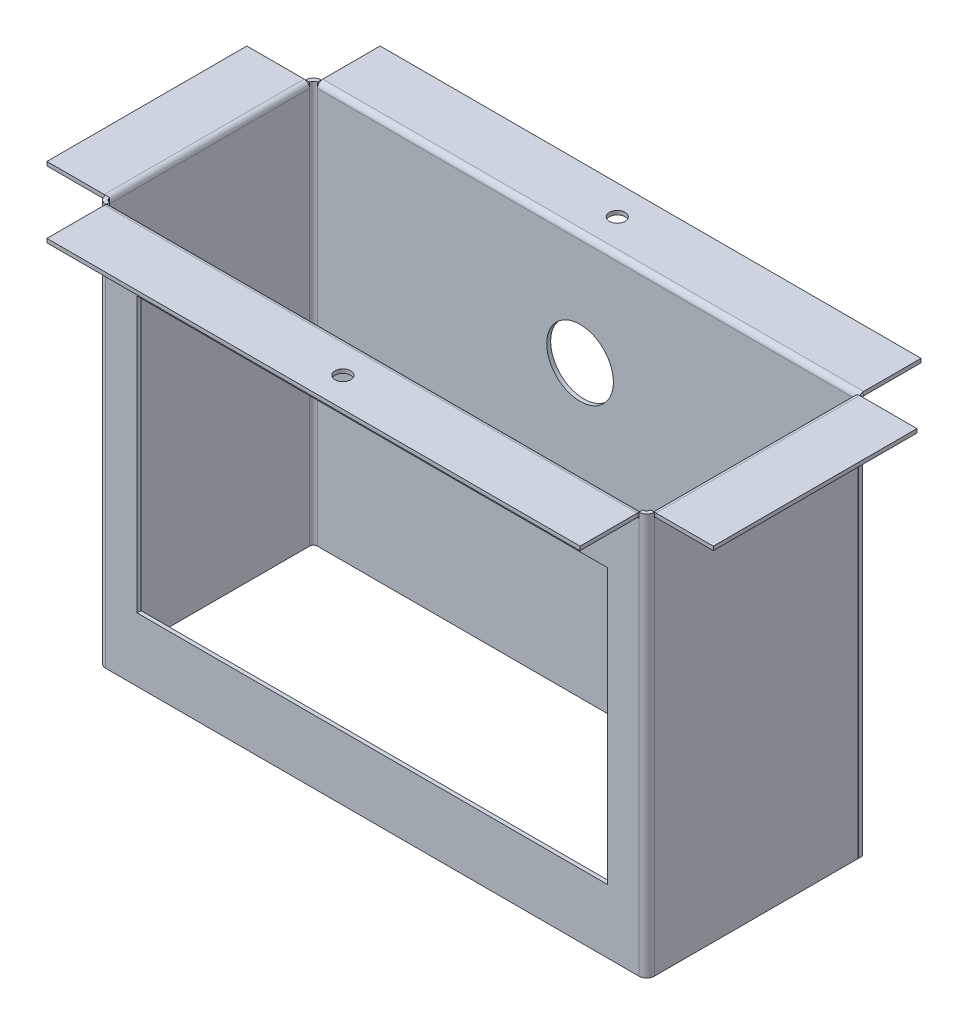
from build123d import *

# Parameters (mm, degrees)
SKETCH1_W                       = 280
SKETCH1_H                       = 205
BASE_FLANGE1_DEPTH              = 2
EDGE_FLANGE1_STRIP_W            = 12
EDGE_FLANGE1_STRIP_H            = 2
EDGE_FLANGE1_STRIP_CUT_DEPTH    = 205
EDGE_FLANGE1_DEPTH              = 205
EDGE_FLANGE2_STRIP_W            = 12
EDGE_FLANGE2_STRIP_H            = 2
EDGE_FLANGE2_STRIP_CUT_DEPTH    = 205
EDGE_FLANGE2_DEPTH              = 205
EDGE_FLANGE3_STRIP_W            = 12
EDGE_FLANGE3_STRIP_H            = 2
EDGE_FLANGE3_STRIP_CUT_DEPTH    = 205
EDGE_FLANGE3_DEPTH              = 205
SKETCH15_W                      = 240
SKETCH15_H                      = 140
CUT_EXTRUDE1_DEPTH              = 10
SKETCH16_R                      = 17
CUT_EXTRUDE2_DEPTH              = 10
EDGE_FLANGE11_STRIP_W           = 9.4732
EDGE_FLANGE11_STRIP_H           = 2
EDGE_FLANGE11_STRIP_CUT_DEPTH   = 276
EDGE_FLANGE11_STRIP_2_W         = 9.4732
EDGE_FLANGE11_STRIP_2_H         = 2
EDGE_FLANGE11_STRIP_CUT_2_DEPTH = 102
EDGE_FLANGE11_STRIP_3_W         = 9.4732
EDGE_FLANGE11_STRIP_3_H         = 2
EDGE_FLANGE11_STRIP_CUT_3_DEPTH = 272
EDGE_FLANGE11_STRIP_4_W         = 9.4732
EDGE_FLANGE11_STRIP_4_H         = 2
EDGE_FLANGE11_STRIP_CUT_4_DEPTH = 103.9
EDGE_FLANGE11_DEPTH             = 276
EDGE_FLANGE11_BEND_DEPTH        = 102
EDGE_FLANGE11_BEND_2_DEPTH      = 272
EDGE_FLANGE11_BEND_3_DEPTH      = 103.9
SKETCH55_R                      = 4
CUT_EXTRUDE3_DEPTH              = 10


# Sheet-metal steps are written as plain solids
with BuildPart() as part:
    # Sketch1 → Base-Flange1 (new body)
    with BuildSketch(Plane.XY):
        with Locations((-95.977777778, -56.488888889)):
            Rectangle(SKETCH1_W, SKETCH1_H)
    extrude(amount=-BASE_FLANGE1_DEPTH)

    # Edge-Flange1 strip (across the edge) → Edge-Flange1 strip cut (cut)
    with BuildSketch(Plane(origin=(-235.977777778, 46.011111111, 0), x_dir=(1, 0, 0), z_dir=(0, -1, 0))):
        with Locations((-2, -1)):
            Rectangle(EDGE_FLANGE1_STRIP_W, EDGE_FLANGE1_STRIP_H)
    extrude(amount=EDGE_FLANGE1_STRIP_CUT_DEPTH, mode=Mode.SUBTRACT)

    # Edge-Flange1 section (across the edge) → Edge-Flange1 (add)
    with BuildSketch(Plane(origin=(-235.977777778, 46.011111111, 0), x_dir=(1, 0, 0), z_dir=(0, -1, 0))):
        with BuildLine():
            Line((0, 2), (0, 108))
            Line((0, 108), (2, 108))
            Line((2, 108), (2, 2))
            ThreePointArc((2, 2), (2.585786438, 0.585786438), (4, 0))
            Line((4, 0), (4, -2))
            ThreePointArc((4, -2), (1.171572875, -0.828427125), (0, 2))
        make_face()
    extrude(amount=EDGE_FLANGE1_DEPTH)

    # Edge-Flange2 strip (across the edge) → Edge-Flange2 strip cut (cut)
    with BuildSketch(Plane(origin=(-233.977777778, 46.011111111, 108), x_dir=(0, 0, -1), z_dir=(0, -1, 0))):
        with Locations((-2, -1)):
            Rectangle(EDGE_FLANGE2_STRIP_W, EDGE_FLANGE2_STRIP_H)
    extrude(amount=EDGE_FLANGE2_STRIP_CUT_DEPTH, mode=Mode.SUBTRACT)

    # Edge-Flange2 section (across the edge) → Edge-Flange2 (add)
    with BuildSketch(Plane(origin=(-233.977777778, 46.011111111, 108), x_dir=(0, 0, -1), z_dir=(0, -1, 0))):
        with BuildLine():
            Line((0, 2), (0, 278))
            Line((0, 278), (2, 278))
            Line((2, 278), (2, 2))
            ThreePointArc((2, 2), (2.585786438, 0.585786438), (4, 0))
            Line((4, 0), (4, -2))
            ThreePointArc((4, -2), (1.171572875, -0.828427125), (0, 2))
        make_face()
    extrude(amount=EDGE_FLANGE2_DEPTH)

    # Edge-Flange3 strip (across the edge) → Edge-Flange3 strip cut (cut)
    with BuildSketch(Plane(origin=(44.022222222, 46.011111111, 106), x_dir=(-1, 0, 0), z_dir=(0, -1, 0))):
        with Locations((-2, -1)):
            Rectangle(EDGE_FLANGE3_STRIP_W, EDGE_FLANGE3_STRIP_H)
    extrude(amount=EDGE_FLANGE3_STRIP_CUT_DEPTH, mode=Mode.SUBTRACT)

    # Edge-Flange3 section (across the edge) → Edge-Flange3 (add)
    with BuildSketch(Plane(origin=(44.022222222, 46.011111111, 106), x_dir=(-1, 0, 0), z_dir=(0, -1, 0))):
        with BuildLine():
            Line((0, 2), (0, 105.9))
            Line((0, 105.9), (2, 105.9))
            Line((2, 105.9), (2, 2))
            ThreePointArc((2, 2), (2.585786438, 0.585786438), (4, 0))
            Line((4, 0), (4, -2))
            ThreePointArc((4, -2), (1.171572875, -0.828427125), (0, 2))
        make_face()
    extrude(amount=EDGE_FLANGE3_DEPTH)

    # Sketch15 → Cut-Extrude1 (cut)
    with BuildSketch(Plane.XY.offset(108)):
        with Locations((-95.977777778, -56.488888889)):
            Rectangle(SKETCH15_W, SKETCH15_H)
    extrude(amount=-CUT_EXTRUDE1_DEPTH, mode=Mode.SUBTRACT)

    # Sketch16 → Cut-Extrude2 (cut)
    with BuildSketch(Plane(origin=(0, 0, -2), x_dir=(-1, 0, 0), z_dir=(0, 0, -1))):
        with Locations((97.977777778, -10.988888889)):
            Circle(SKETCH16_R)
    extrude(amount=-CUT_EXTRUDE2_DEPTH, mode=Mode.SUBTRACT)

    # Edge-Flange11 strip (across the edge) → Edge-Flange11 strip cut (cut)
    with BuildSketch(Plane(origin=(-231.977777778, 46.011111111, -2), x_dir=(0, -1, 0), z_dir=(1, 0, 0))):
        with Locations((-2, -1)):
            Rectangle(EDGE_FLANGE11_STRIP_W, EDGE_FLANGE11_STRIP_H)
    extrude(amount=EDGE_FLANGE11_STRIP_CUT_DEPTH, mode=Mode.SUBTRACT)

    # Edge-Flange11 strip 2 (across the edge) → Edge-Flange11 strip cut 2 (cut)
    with BuildSketch(Plane(origin=(-235.977777778, 46.011111111, 104), x_dir=(0, -1, 0), z_dir=(0, 0, -1))):
        with Locations((-2, -1)):
            Rectangle(EDGE_FLANGE11_STRIP_2_W, EDGE_FLANGE11_STRIP_2_H)
    extrude(amount=EDGE_FLANGE11_STRIP_CUT_2_DEPTH, mode=Mode.SUBTRACT)

    # Edge-Flange11 strip 3 (across the edge) → Edge-Flange11 strip cut 3 (cut)
    with BuildSketch(Plane(origin=(40.022222222, 46.011111111, 108), x_dir=(0, -1, 0), z_dir=(-1, 0, 0))):
        with Locations((-2, -1)):
            Rectangle(EDGE_FLANGE11_STRIP_3_W, EDGE_FLANGE11_STRIP_3_H)
    extrude(amount=EDGE_FLANGE11_STRIP_CUT_3_DEPTH, mode=Mode.SUBTRACT)

    # Edge-Flange11 strip 4 (across the edge) → Edge-Flange11 strip cut 4 (cut)
    with BuildSketch(Plane(origin=(44.022222222, 46.011111111, 0.1), x_dir=(0, -1, 0), z_dir=(0, 0, 1))):
        with Locations((-2, -1)):
            Rectangle(EDGE_FLANGE11_STRIP_4_W, EDGE_FLANGE11_STRIP_4_H)
    extrude(amount=EDGE_FLANGE11_STRIP_CUT_4_DEPTH, mode=Mode.SUBTRACT)

    # Edge-Flange11 section (across the edge) → Edge-Flange11 (add)
    with BuildSketch(Plane(origin=(-231.977777778, 46.011111111, -2), x_dir=(0, -1, 0), z_dir=(1, 0, 0))):
        with BuildLine():
            Line((0, 0.7366), (0, 30))
            Line((0, 30), (2, 30))
            Line((2, 30), (2, 0.7366))
            ThreePointArc((2, 0.7366), (2.215745145, 0.215745145), (2.7366, 0))
            Line((2.7366, 0), (2.7366, -2))
            ThreePointArc((2.7366, -2), (0.801531583, -1.198468417), (0, 0.7366))
        make_face()
    extrude(amount=EDGE_FLANGE11_DEPTH)

    # Edge-Flange11 section 2 (across the edge) → Edge-Flange11 bend (add)
    with BuildSketch(Plane(origin=(-235.977777778, 46.011111111, 104), x_dir=(0, -1, 0), z_dir=(0, 0, -1))):
        with BuildLine():
            Line((0, 0.7366), (0, 30))
            Line((0, 30), (2, 30))
            Line((2, 30), (2, 0.7366))
            ThreePointArc((2, 0.7366), (2.215745145, 0.215745145), (2.7366, 0))
            Line((2.7366, 0), (2.7366, -2))
            ThreePointArc((2.7366, -2), (0.801531583, -1.198468417), (0, 0.7366))
        make_face()
    extrude(amount=EDGE_FLANGE11_BEND_DEPTH)

    # Edge-Flange11 section 3 (across the edge) → Edge-Flange11 bend 2 (add)
    with BuildSketch(Plane(origin=(40.022222222, 46.011111111, 108), x_dir=(0, -1, 0), z_dir=(-1, 0, 0))):
        with BuildLine():
            Line((0, 0.7366), (0, 30))
            Line((0, 30), (2, 30))
            Line((2, 30), (2, 0.7366))
            ThreePointArc((2, 0.7366), (2.215745145, 0.215745145), (2.7366, 0))
            Line((2.7366, 0), (2.7366, -2))
            ThreePointArc((2.7366, -2), (0.801531583, -1.198468417), (0, 0.7366))
        make_face()
    extrude(amount=EDGE_FLANGE11_BEND_2_DEPTH)

    # Edge-Flange11 section 4 (across the edge) → Edge-Flange11 bend 3 (add)
    with BuildSketch(Plane(origin=(44.022222222, 46.011111111, 0.1), x_dir=(0, -1, 0), z_dir=(0, 0, 1))):
        with BuildLine():
            Line((0, 0.7366), (0, 30))
            Line((0, 30), (2, 30))
            Line((2, 30), (2, 0.7366))
            ThreePointArc((2, 0.7366), (2.215745145, 0.215745145), (2.7366, 0))
            Line((2.7366, 0), (2.7366, -2))
            ThreePointArc((2.7366, -2), (0.801531583, -1.198468417), (0, 0.7366))
        make_face()
    extrude(amount=EDGE_FLANGE11_BEND_3_DEPTH)

    # Sketch55 → Cut-Extrude3 (cut)
    with BuildSketch(Plane.XZ.offset(-44.011111111)):
        with Locations(Location((-95.977777778, -17, 0), (0, 0, 270))):
            Circle(SKETCH55_R)
        with Locations(Location((-95.977777778, 123, 0), (0, 0, 270))):
            Circle(SKETCH55_R)
    extrude(amount=-CUT_EXTRUDE3_DEPTH, mode=Mode.SUBTRACT)


solid = part.part
